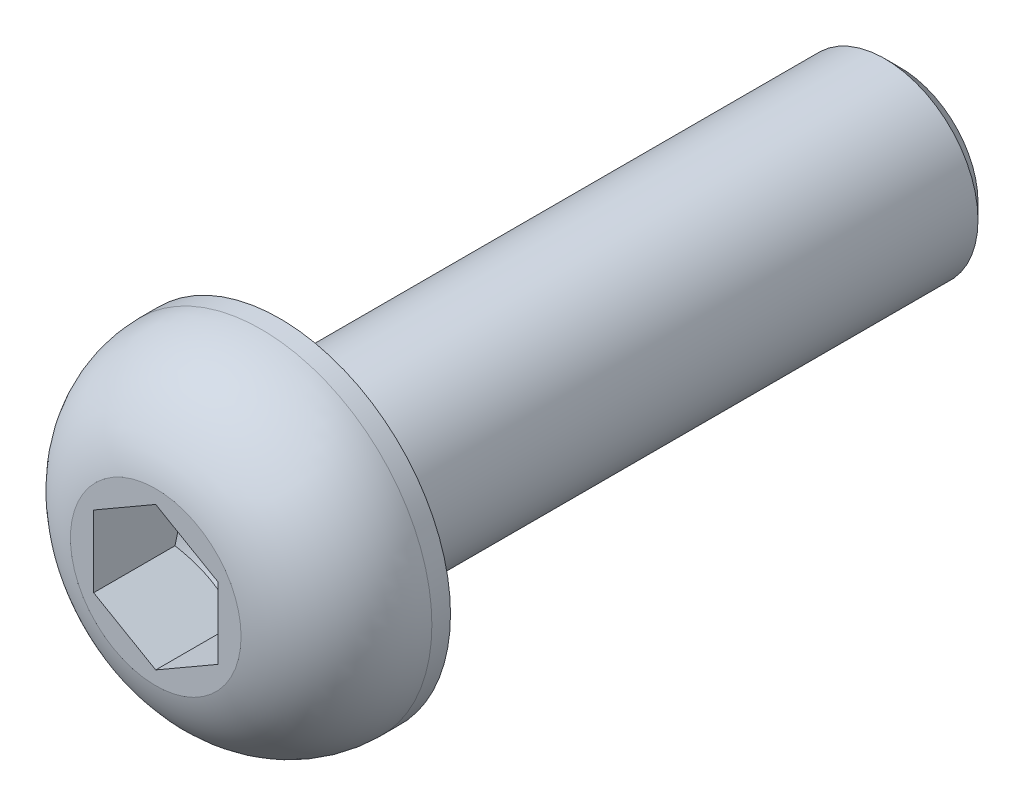
from build123d import *

# Parameters (mm, degrees)
CHAMFER1_SIZE      = 0.25
CUT_EXTRUDE1_START = -1.4000001
CUT_EXTRUDE1_DEPTH = 1.4000001
FILLET1_R          = 0.1


with BuildPart() as part:
    # Sketch1 → Revolve1 (revolve)
    with BuildSketch(Plane(origin=(0, 0, 0), x_dir=(0, 0, -1), z_dir=(1, 0, 0)), mode=Mode.PRIVATE) as revolve1_sk:
        with BuildLine():
            Line((10, 0), (10, 1.5))
            Line((10, 1.5), (0, 1.5))
            Line((0, 1.5), (0, 2.75))
            Line((0, 2.75), (-0.3, 2.75))
            ThreePointArc((-0.3, 2.75), (-1.39323202, 2.363223225), (-2, 1.375))
            Line((-2, 1.375), (-2, 0))
            Line((-2, 0), (10, 0))
        make_face()
    revolve(revolve1_sk.sketch.rotate(Axis((0, 0, 30.809969789), (0, 0, -1)), 90), axis=Axis((0, 0, 30.809969789), (0, 0, -1)))

    # Chamfer1
    chamfer1_edges = [part.edges().sort_by_distance(p)[0] for p in [
        (-1.5, 0, -10),
    ]]
    chamfer(chamfer1_edges, length=CHAMFER1_SIZE)

    # Sketch2 → Cut-Revolve1 (revolve, cut)
    with BuildSketch(Plane(origin=(0, 0, 0), x_dir=(0, 0, -1), z_dir=(1, 0, 0)), mode=Mode.PRIVATE) as cut_revolve1_sk:
        Polygon((-2, 0), (-2, 1), (-0.6, 1), (-0.022649731, 0), align=None)
    revolve(cut_revolve1_sk.sketch.rotate(Axis((0, 0, 2.452500839), (0, 0, -1)), 90), axis=Axis((0, 0, 2.452500839), (0, 0, -1)), mode=Mode.SUBTRACT)

    # Cut-Extrude1: read off the stored shape, not the designer's step
    # Cut-Extrude1 outline → Cut-Extrude1 (cut)
    with BuildSketch(Plane.XY.offset(2).offset(CUT_EXTRUDE1_START)):
        with BuildLine():
            Line((1, 0), (1, 0.577350269))
            Line((1, 0.577350269), (0.500019222, 0.866014306))
            ThreePointArc((0.500019222, 0.866014306), (0.866030953, 0.499990389), (1, 0))
        make_face()
        with BuildLine():
            ThreePointArc((-0.500019222, 0.866014306), (0, 1), (0.500019222, 0.866014306))
            Line((0.500019222, 0.866014306), (0, 1.154700538))
            Line((0, 1.154700538), (-0.500019222, 0.866014306))
        make_face()
        with BuildLine():
            Line((1, -0.577350269), (1, 0))
            ThreePointArc((1, 0), (0.866030953, -0.499990389), (0.500019222, -0.866014306))
            Line((0.500019222, -0.866014306), (1, -0.577350269))
        make_face()
        with BuildLine():
            ThreePointArc((-1, 0), (-0.866030953, 0.499990389), (-0.500019222, 0.866014306))
            Line((-0.500019222, 0.866014306), (-1, 0.577350269))
            Line((-1, 0.577350269), (-1, 0))
        make_face()
        with BuildLine():
            Line((0, -1.154700538), (0.500019222, -0.866014306))
            ThreePointArc((0.500019222, -0.866014306), (0, -1), (-0.500019222, -0.866014306))
            Line((-0.500019222, -0.866014306), (0, -1.154700538))
        make_face()
        with BuildLine():
            ThreePointArc((-0.500019222, -0.866014306), (-0.866030953, -0.499990389), (-1, 0))
            Line((-1, 0), (-1, -0.577350269))
            Line((-1, -0.577350269), (-0.500019222, -0.866014306))
        make_face()
    extrude(amount=CUT_EXTRUDE1_DEPTH, mode=Mode.SUBTRACT)

    # Cut-Extrude1 2 outline → Cut-Extrude1 2 (revolve)
    with BuildSketch(Plane.XZ):
        Polygon((1.154700598, 0.689316432), (0.999999957, 0.599999975), (1.154700538, 0.5999999), align=None)
    revolve(axis=Axis((0, 0, 0), (0, 0, 1)))

    # Fillet1
    fillet1_edges = [part.edges().sort_by_distance(p)[0] for p in [
        (-1.5, 0, 0),
    ]]
    fillet(fillet1_edges, radius=FILLET1_R)


solid = part.part
